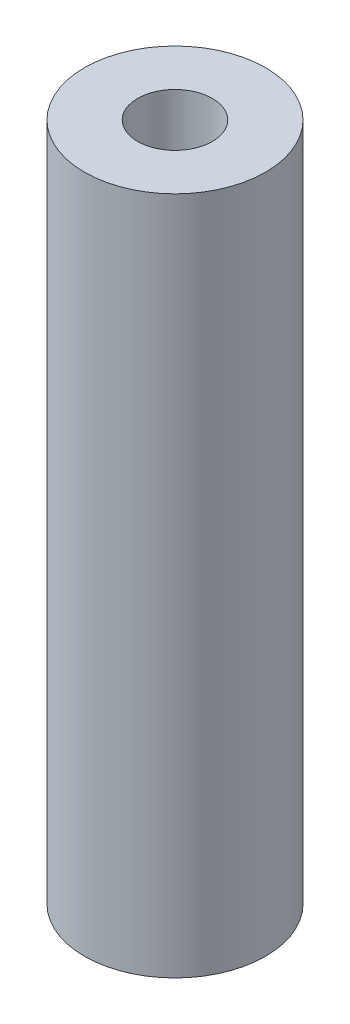
from build123d import *

# Parameters (mm, degrees)
SKETCH_1_R      = 4
EXTRUDE_1_DEPTH = 30
M4X0_71_D       = 3.3


with BuildPart() as part:
    # Эскиз1 → Бобышка-Вытянуть1 (new body)
    with BuildSketch(Plane(origin=(0, 0, 0), x_dir=(1, 0, 0), z_dir=(0, 1, 0))):
        Circle(SKETCH_1_R)
    extrude(amount=EXTRUDE_1_DEPTH)

    # Отверстие обработанное метчиком M4x0.71 (through all)
    with Locations(Plane(origin=(0, 0, 0), x_dir=(-1, 0, 0), z_dir=(0, -1, 0))):
        with Locations((0, 0)):
            Hole(M4X0_71_D / 2)


solid = part.part
